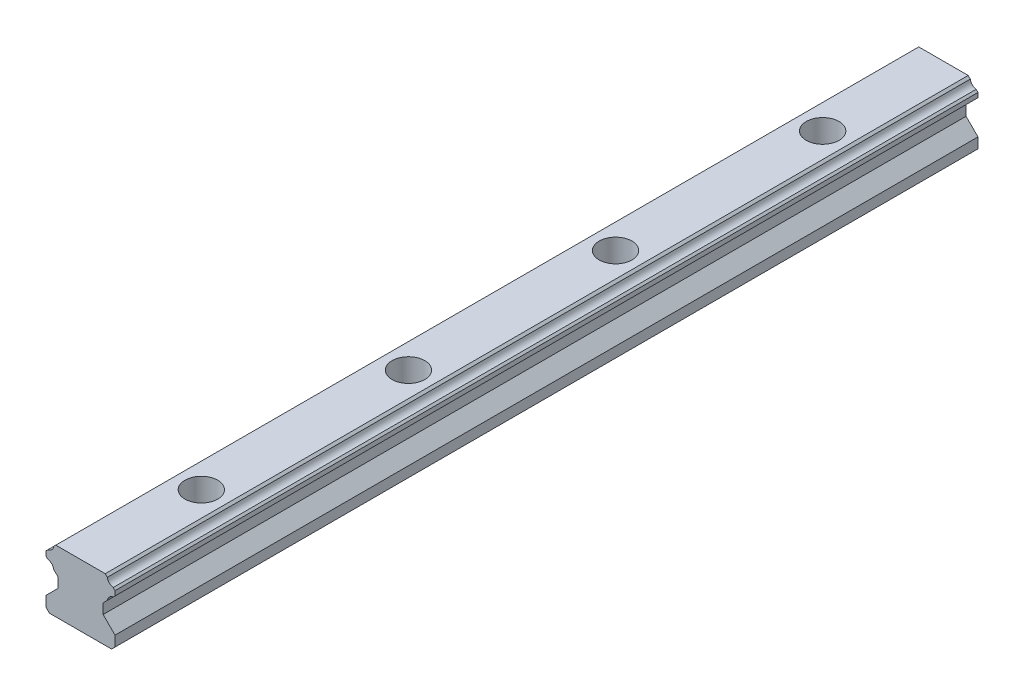
from build123d import *

# Parameters (mm, degrees)
BOSS_EXTRUDE1_DEPTH = 125
SKETCH2_R           = 3
CUT_EXTRUDE1_DEPTH  = 127.684647847
SKETCH3_R           = 4.75
CUT_EXTRUDE2_DEPTH  = 8.5
LPATTERN1_COUNT     = 100
LPATTERN1_PITCH     = 60


with BuildPart() as part:
    # Sketch1 → Boss-Extrude1 (new body)
    with BuildSketch(Plane.XY):
        with BuildLine():
            Line((-6.55, 1.465), (-6.55, -1.465))
            Line((-6.55, -1.465), (-10, -4.915))
            Line((-10, -4.915), (-10, -7.915))
            Line((-10, -7.915), (-9, -8.915))
            Line((-9, -8.915), (0, -8.915))
            Line((0, -8.915), (0, 9.085))
            Line((0, 9.085), (-7.16, 9.085))
            Line((-7.16, 9.085), (-7.768111832, 8.476888168))
            ThreePointArc((-7.768111832, 8.476888168), (-8.334356479, 7.341574733), (-9.469669914, 6.775330086))
            Line((-9.469669914, 6.775330086), (-10, 6.245))
            Line((-10, 6.245), (-10, 4.915))
            Line((-10, 4.915), (-9.469669914, 4.384669914))
            ThreePointArc((-9.469669914, 4.384669914), (-8.334356479, 3.818425267), (-7.768111832, 2.683111832))
            Line((-7.768111832, 2.683111832), (-6.55, 1.465))
        make_face()
    boss_extrude1 = extrude(amount=BOSS_EXTRUDE1_DEPTH)

    # Mirror1: Boss-Extrude1 across plane
    add(boss_extrude1.mirror(Plane(origin=(0, 9.085, 125), x_dir=(0, 0, 1), z_dir=(-1, 0, 0))))

    # Sketch2 → Cut-Extrude1 (cut, through all)
    with BuildSketch(Plane(origin=(0, 9.085, 0), x_dir=(1, 0, 0), z_dir=(0, 1, 0))):
        with Locations((0, -30)):
            Circle(SKETCH2_R)
    cut_extrude1 = extrude(amount=-CUT_EXTRUDE1_DEPTH, mode=Mode.SUBTRACT)

    # Sketch3 → Cut-Extrude2 (cut)
    with BuildSketch(Plane(origin=(0, 9.085, 0), x_dir=(1, 0, 0), z_dir=(0, 1, 0))):
        with Locations((0, -30)):
            Circle(SKETCH3_R)
    cut_extrude2 = extrude(amount=-CUT_EXTRUDE2_DEPTH, mode=Mode.SUBTRACT)

    # LPattern1: Cut-Extrude1, Cut-Extrude2 ×100
    with Locations(*[(0, 0, i * LPATTERN1_PITCH) for i in range(1, LPATTERN1_COUNT)]):
        add(cut_extrude1, mode=Mode.SUBTRACT)
        add(cut_extrude2, mode=Mode.SUBTRACT)

    # Mirror2: part across plane


with BuildPart() as part_1:
    add(part.part)
    add(part.part.mirror(Plane(origin=(-9.748570041, 2.404211705, 0), x_dir=(1, 0, 0), z_dir=(0, 0, -1))))


solid = part_1.part
